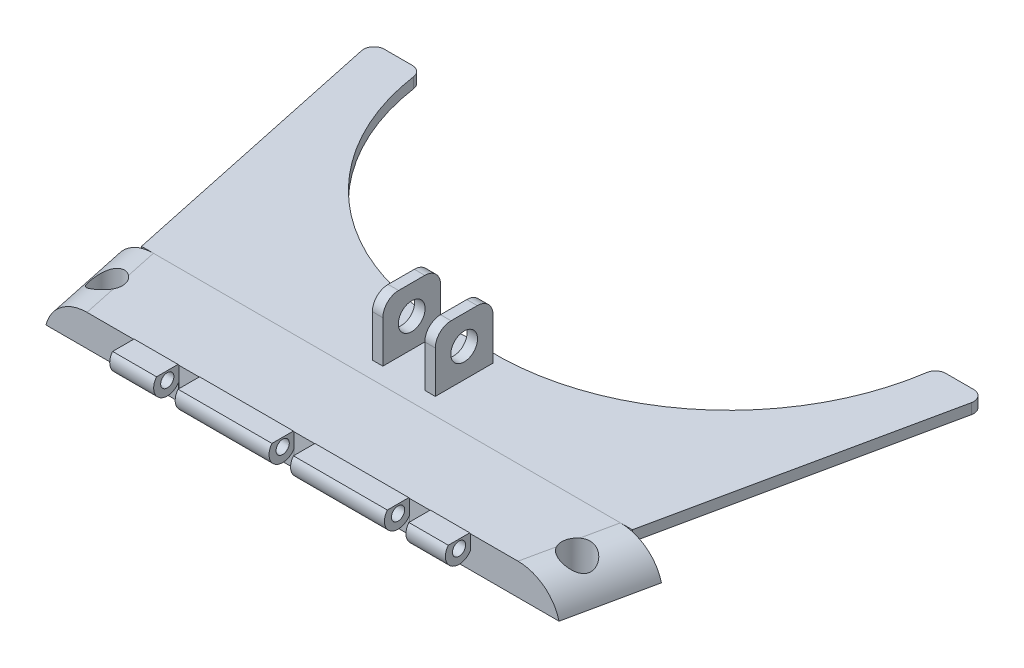
from build123d import *

# Parameters (mm, degrees)
BOSS_EXTRUDE1_DEPTH      = 2.54
BOSS_EXTRUDE2_DEPTH      = 21.59
BOSS_EXTRUDE2_DEPTH_BACK = 0.254
SKETCH1_4_W              = 2.54
SKETCH1_4_H              = 13.97
FILLET1_R                = 3.81
SKETCH3_R                = 3.239723986
CUT_EXTRUDE1_DEPTH       = 16.764
BOSS_EXTRUDE5_DEPTH      = 7.62
FILLET4_R                = 10
FILLET5_R                = 10
SKETCH15_R               = 3.297816404
BOSS_EXTRUDE6_DEPTH      = 40.64
SKETCH16_W               = 5.20912403
SKETCH16_H               = 19.895362302
CUT_EXTRUDE22_DEPTH      = 40.64
SKETCH17_R               = 1.602698747
CUT_EXTRUDE23_DEPTH      = 122.936
SKETCH18_W               = 85.09
SKETCH18_H               = 1.27
CUT_EXTRUDE31_DEPTH      = 29.181994356


with BuildPart() as part:
    # Sketch2 → Boss-Extrude1 (new body)
    with BuildSketch(Plane(origin=(0, 7.62, 0), x_dir=(1, 0, 0), z_dir=(0, 1, 0))):
        with BuildLine():
            Line((-73.818493285, 15.094601754), (-59.43400053, -52.579115969))
            Line((-59.43400053, -52.579115969), (0, -52.579115969))
            Line((0, -52.579115969), (0, -32.081773998))
            ThreePointArc((0, -32.081773998), (-40.726069255, -20.552510977), (-62.081483612, 15.991748496))
            ThreePointArc((-62.081483612, 15.991748496), (-62.934076533, 17.544804321), (-64.594529836, 18.162697448))
            Line((-64.594529836, 18.162697448), (-71.333998379, 18.162697448))
            ThreePointArc((-71.333998379, 18.162697448), (-73.307949121, 17.221171242), (-73.818493285, 15.094601754))
        make_face()
    extrude(amount=-BOSS_EXTRUDE1_DEPTH)

    # Sketch1<4> → Boss-Extrude2 (add, two sides: drawn at the far end of the back side and taken through both)
    with BuildSketch(Plane(origin=(0, 0, 0), x_dir=(1, 0, 0), z_dir=(0, 1, 0)).offset(-BOSS_EXTRUDE2_DEPTH_BACK)):
        with Locations((-6.35, -41.496656363)):
            Rectangle(SKETCH1_4_W, SKETCH1_4_H)
    extrude(amount=BOSS_EXTRUDE2_DEPTH + BOSS_EXTRUDE2_DEPTH_BACK)

    # Fillet1
    fillet1_edges = [part.edges().sort_by_distance(p)[0] for p in [
        (-6.35, 21.59, 34.511656363),
        (-6.35, 21.59, 48.481656363),
    ]]
    fillet(fillet1_edges, radius=FILLET1_R)

    # Sketch3 → Cut-Extrude1 (cut)
    with BuildSketch(Plane(origin=(-5.08, 0, 0), x_dir=(0, 0, -1), z_dir=(1, 0, 0))):
        with Locations((-41.496656363, 14.605)):
            Circle(SKETCH3_R)
    extrude(amount=-CUT_EXTRUDE1_DEPTH, mode=Mode.SUBTRACT)

    # Mirror2: part across plane


with BuildPart() as part_1:
    add(part.part)
    add(part.part.mirror(Plane(origin=(0, 0, 0), x_dir=(0, 0, 1), z_dir=(1, 0, 0))))


with BuildPart() as body_2:
    # Sketch8 → Boss-Extrude5 (new body)
    with BuildSketch(Plane(origin=(0, 7.62, 0), x_dir=(1, 0, 0), z_dir=(0, 1, 0))):
        with BuildLine():
            Line((-57.9564032, -59.530664861), (-59.43400053, -52.579115969))
            Line((-59.43400053, -52.579115969), (-66.462790345, -52.579115969))
            Line((-66.462790345, -52.579115969), (-62.114635625, -73.015992643))
            Line((-62.114635625, -73.015992643), (-55.090008293, -73.015992643))
            Line((-55.090008293, -73.015992643), (-56.41421099, -66.786108765))
            ThreePointArc((-56.41421099, -66.786108765), (-60.813029047, -63.929482917), (-57.9564032, -59.530664861))
        make_face()
        with BuildLine():
            Line((0, -52.579115969), (-59.43400053, -52.579115969))
            Line((-59.43400053, -52.579115969), (-57.9564032, -59.530664861))
            ThreePointArc((-57.9564032, -59.530664861), (-54.851304133, -60.276133192), (-53.476539677, -63.158386813))
            ThreePointArc((-53.476539677, -63.158386813), (-54.303053474, -65.492389775), (-56.41421099, -66.786108765))
            Line((-56.41421099, -66.786108765), (-55.090008293, -73.015992643))
            Line((-55.090008293, -73.015992643), (-0.083063423, -73.015992643))
            Line((-0.083063423, -73.015992643), (0, -52.579115969))
        make_face()
        with BuildLine():
            Line((59.43400053, -52.579115969), (0, -52.579115969))
            Line((0, -52.579115969), (-0.083063423, -73.015992643))
            Line((-0.083063423, -73.015992643), (54.923881447, -73.015992643))
            Line((54.923881447, -73.015992643), (56.202518107, -67.222056998))
            ThreePointArc((56.202518107, -67.222056998), (53.475797116, -62.823636648), (57.800436405, -59.981348141))
            Line((57.800436405, -59.981348141), (59.43400053, -52.579115969))
        make_face()
        with BuildLine():
            Line((66.462790345, -52.579115969), (59.43400053, -52.579115969))
            Line((59.43400053, -52.579115969), (57.800436405, -59.981348141))
            ThreePointArc((57.800436405, -59.981348141), (59.957691037, -61.261982275), (60.806190096, -63.622876318))
            ThreePointArc((60.806190096, -63.622876318), (59.381712813, -66.544686431), (56.202518107, -67.222056998))
            Line((56.202518107, -67.222056998), (54.923881447, -73.015992643))
            Line((54.923881447, -73.015992643), (62.114635625, -73.015992643))
            Line((62.114635625, -73.015992643), (66.462790345, -52.579115969))
        make_face()
    extrude(amount=-BOSS_EXTRUDE5_DEPTH)

    # Fillet4
    # the kernel refuses this fillet: 10 mm, written as the material it takes off along each edge
    with BuildSketch(Plane(origin=(57.061573022, 7.62, 96.76602545), x_dir=(-0.9781070679301612, 0, -0.20810229134986202), z_dir=(0.20810229134986202, 0, -0.9781070679301613))) as fillet4_piece_1:
        with BuildLine():
            CenterArc((9.712651543, -10), FILLET4_R, 90, 76.231471248)
            Line((0, -7.62), (-0.194253031, -7.5724))
            ThreePointArc((-0.194253031, -7.5724), (-0.2, -3.81), (-0.2, 0))
            Line((-0.2, 0), (0, 0.2))
            Line((0, 0.2), (9.712651543, 0.2))
            Line((9.712651543, 0.2), (9.712651543, 0))
        make_face()
    extrude(amount=69.457572198, mode=Mode.SUBTRACT)

    # Fillet5
    # the kernel refuses this fillet: 10 mm, written as the material it takes off along each edge
    with BuildSketch(Plane(origin=(-71.515852948, 7.62, 28.829083162), x_dir=(0.9781070679301614, 0, -0.20810229134986197), z_dir=(0.20810229134986197, 0, 0.9781070679301613))) as fillet5_piece_1:
        with BuildLine():
            CenterArc((9.712651543, -10), FILLET5_R, 90, 76.231471248)
            Line((0, -7.62), (0, 0))
            Line((0, 0), (9.712651543, 0))
        make_face()
    extrude(amount=69.457572198, mode=Mode.SUBTRACT)

    # Sketch15 → Boss-Extrude6 (add, symmetric)
    with BuildSketch(Plane(origin=(0, 0, 0), x_dir=(0, 0, -1), z_dir=(1, 0, 0))):
        with Locations((-75.762369655, 5.844066985)):
            Circle(SKETCH15_R)
    extrude(amount=BOSS_EXTRUDE6_DEPTH, both=True)

    # Sketch16 → Cut-Extrude22 (cut, symmetric)
    with BuildSketch(Plane(origin=(0, 7.62, 0), x_dir=(1, 0, 0), z_dir=(0, 1, 0))):
        with Locations((0.543495376, -82.931264207)):
            Rectangle(SKETCH16_W, SKETCH16_H)
        with Locations((28.483495376, -82.931264207)):
            Rectangle(SKETCH16_W, SKETCH16_H)
        with Locations((-27.396504624, -82.931264207)):
            Rectangle(SKETCH16_W, SKETCH16_H)
    extrude(amount=CUT_EXTRUDE22_DEPTH, both=True, mode=Mode.SUBTRACT)

    # Sketch17 → Cut-Extrude23 (cut)
    with BuildSketch(Plane(origin=(40.64, 0, 0), x_dir=(0, 0, -1), z_dir=(1, 0, 0))):
        with Locations((-75.762369655, 5.844066985)):
            Circle(SKETCH17_R)
    extrude(amount=-CUT_EXTRUDE23_DEPTH, mode=Mode.SUBTRACT)

    # Sketch18 → Cut-Extrude31 (cut)
    with BuildSketch(Plane.XY.offset(69.871682927)):
        with Locations((1.905, 8.506883389)):
            Rectangle(SKETCH18_W, SKETCH18_H)
    extrude(amount=CUT_EXTRUDE31_DEPTH, mode=Mode.SUBTRACT)


solid = Compound([part_1.part, body_2.part])
